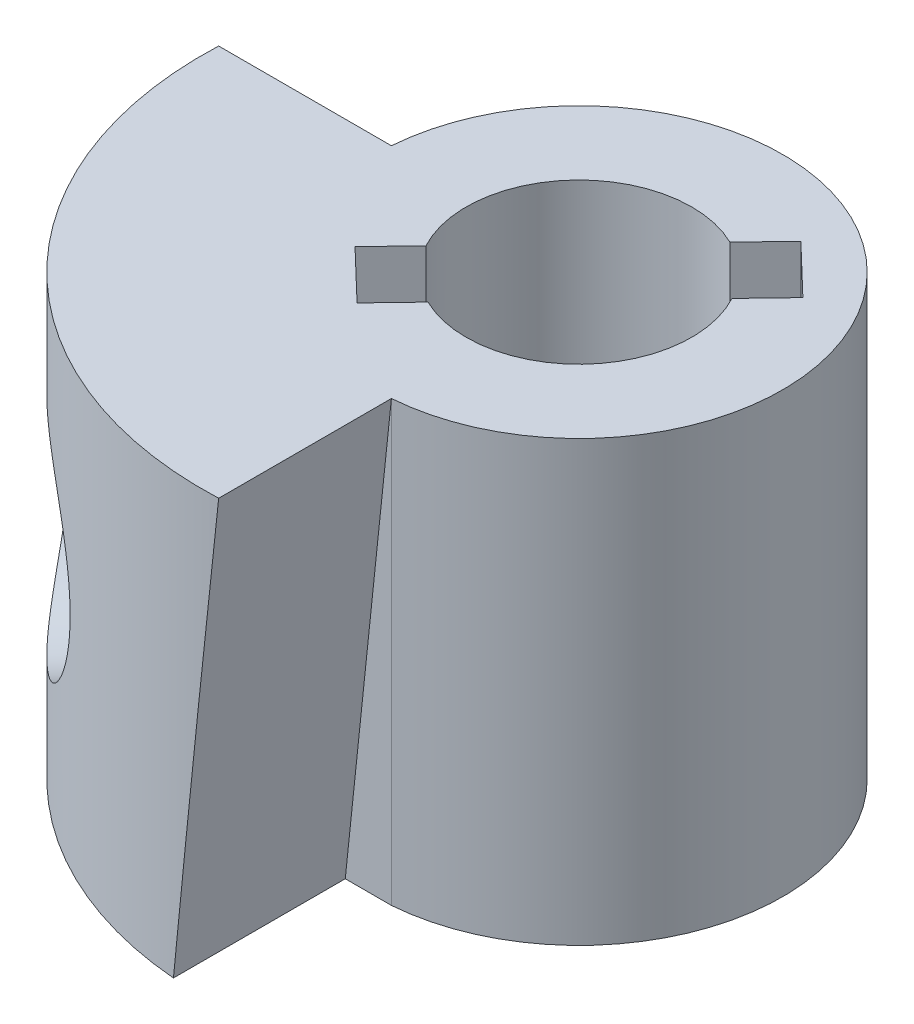
from build123d import *

# Parameters (mm, degrees)
MAIN_BODY_DEPTH                        = 7
FLANG_CUT_RIGHT_DEPTH                  = 2.754419
FLANG_CUT_RIGHT_DIRECTION_2_REACH      = 15.268
FLANG_CUT_RIGHT_DIRECTION_2_END_RADIUS = 6
FLANG_CUT_LEFT_DEPTH                   = 2.754419
FLANG_CUT_LEFT_DIRECTION_2_REACH       = 17.116
FLANG_CUT_LEFT_DIRECTION_2_END_RADIUS  = 6
GUIDE_CUTS_DEPTH                       = 14.586908947


# Read off the part's stored shape, not the designer's step: CSK SLOT for M1.6 Countersunk Flat Head Screw9
with BuildPart() as part:
    # Sketch1 → main body (new body)
    with BuildSketch(Plane(origin=(0, 0, 0), x_dir=(1, 0, 0), z_dir=(0, 1, 0))):
        with BuildLine():
            Line((-0.042515674, 6.696868743), (-2.796934729, 6.696868743))
            ThreePointArc((-2.796934729, 6.696868743), (-1.044786012, 2.204228056), (3.447854676, 0.452079339))
            Line((3.447854676, 0.452079339), (3.447854676, 3.206498394))
            ThreePointArc((3.447854676, 3.206498394), (0.899757637, 4.148771704), (-0.042515674, 6.696868743))
        make_face()
        with BuildLine():
            Line((1.415300329, 6.696868743), (-0.042515674, 6.696868743))
            ThreePointArc((-0.042515674, 6.696868743), (0.899757637, 4.148771704), (3.447854676, 3.206498394))
            Line((3.447854676, 3.206498394), (3.447854676, 4.664314396))
            ThreePointArc((3.447854676, 4.664314396), (1.925062469, 5.174076537), (1.415300329, 6.696868743))
        make_face()
        with BuildLine():
            ThreePointArc((6.447854676, 6.446868743), (3.322947371, 9.694460438), (-0.042515674, 6.696868743))
            Line((-0.042515674, 6.696868743), (1.415300329, 6.696868743))
            ThreePointArc((1.415300329, 6.696868743), (1.907300469, 7.701647544), (2.897854676, 8.221692678))
            ThreePointArc((2.897854676, 8.221692678), (4.470646882, 7.719660949), (4.972678611, 6.146868743))
            ThreePointArc((4.972678611, 6.146868743), (4.452633477, 5.156314537), (3.447854676, 4.664314396))
            Line((3.447854676, 4.664314396), (3.447854676, 3.206498394))
            ThreePointArc((3.447854676, 3.206498394), (5.582702679, 4.238928527), (6.447854676, 6.446868743))
        make_face()
    extrude(amount=MAIN_BODY_DEPTH)

    # Sketch15 → flang cut right (cut)
    with BuildSketch(Plane(origin=(0, 0, -0.452079339), x_dir=(0, -1, 0), z_dir=(0, 0, 1))):
        Polygon((0, 3.447854676), (0, 2.712125029), (-7, 3.447854676), align=None)
    extrude(amount=-FLANG_CUT_RIGHT_DEPTH, mode=Mode.SUBTRACT)

    # flang cut right direction 2: up to this cylinder (the profile starts inside it)
    flang_cut_right_direction_2_end = Plane(origin=(3.197854676, 2.333333, -6.446868743), z_dir=(0, -1, 0)) * Cylinder(FLANG_CUT_RIGHT_DIRECTION_2_END_RADIUS, 43.536, mode=Mode.PRIVATE)
    # Sketch15 → flang cut right direction 2 (cut, up to the surface)
    with BuildSketch(Plane(origin=(0, 0, -0.452079339), x_dir=(0, -1, 0), z_dir=(0, 0, 1)), mode=Mode.PRIVATE) as flang_cut_right_direction_2_sk1:
        Polygon((0, 3.447854676), (0, 2.712125029), (-7, 3.447854676), align=None)
    flang_cut_right_direction_2_tool1 = extrude(flang_cut_right_direction_2_sk1.sketch, amount=FLANG_CUT_RIGHT_DIRECTION_2_REACH, mode=Mode.PRIVATE) & flang_cut_right_direction_2_end
    add(flang_cut_right_direction_2_tool1.solids().sort_by_distance((3.202611, 2.333333, -0.452079))[0], mode=Mode.SUBTRACT)

    # Sketch13 → flang cut left (cut)
    with BuildSketch(Plane(origin=(-2.796934729, 0, 0), x_dir=(0, 0, -1), z_dir=(1, 0, 0))):
        Polygon((6.696868743, 0), (6.696868743, 7), (5.7130829, 0), align=None)
    extrude(amount=FLANG_CUT_LEFT_DEPTH, mode=Mode.SUBTRACT)

    # flang cut left direction 2: up to this cylinder (the profile starts inside it)
    flang_cut_left_direction_2_end = Plane(origin=(3.197854676, 2.333333, -6.446868743), z_dir=(0, -1, 0)) * Cylinder(FLANG_CUT_LEFT_DIRECTION_2_END_RADIUS, 47.232, mode=Mode.PRIVATE)
    # Sketch13 → flang cut left direction 2 (cut, up to the surface)
    with BuildSketch(Plane(origin=(-2.796934729, 0, 0), x_dir=(0, 0, -1), z_dir=(1, 0, 0)), mode=Mode.PRIVATE) as flang_cut_left_direction_2_sk1:
        Polygon((6.696868743, 0), (6.696868743, 7), (5.7130829, 0), align=None)
    flang_cut_left_direction_2_tool1 = extrude(flang_cut_left_direction_2_sk1.sketch, amount=-FLANG_CUT_LEFT_DIRECTION_2_REACH, mode=Mode.PRIVATE) & flang_cut_left_direction_2_end
    add(flang_cut_left_direction_2_tool1.solids().sort_by_distance((-2.796935, 2.333333, -6.36894))[0], mode=Mode.SUBTRACT)

    # CSK SLOT for M1.6 Countersunk Flat H 2 → CSK SLOT for M1.6 Countersunk Flat Head Screw9 (revolve, cut)
    with BuildSketch(Plane(origin=(-1.673520994, 3.5, -1.59907768), x_dir=(0.723004631868789, 0, 0.6908431821305592), z_dir=(0, 1, 0))):
        Polygon((0.9, 4.170332063), (0.9, 5.425223714), (0, 5.425223714), (0, 0.870183673), (1.8, 0.870183673), (1.8, 3.270332063), align=None)
    revolve(axis=Axis((-1.673520994, 3.5, -1.59907768), (0.6908431821305593, 0, -0.7230046318687892)), mode=Mode.SUBTRACT)

    # Sketch11 → guide cuts (cut, through all)
    with BuildSketch(Plane.XZ):
        with BuildLine():
            Line((1.060664016, -5.013453966), (1.614472941, -5.59077162))
            ThreePointArc((1.614472941, -5.59077162), (1.951784592, -5.147904022), (2.408284716, -4.829284347))
            Line((2.408284716, -4.829284347), (1.85447579, -4.251966693))
            Line((1.85447579, -4.251966693), (1.060664016, -5.013453966))
        make_face()
        with BuildLine():
            Line((5.335045336, -7.88028352), (4.78123641, -7.302965866))
            ThreePointArc((4.78123641, -7.302965866), (4.443924759, -7.745833465), (3.987424635, -8.064453139))
            Line((3.987424635, -8.064453139), (4.541233561, -8.641770793))
            Line((4.541233561, -8.641770793), (5.335045336, -7.88028352))
        make_face()
    extrude(amount=-GUIDE_CUTS_DEPTH, mode=Mode.SUBTRACT)


solid = part.part
